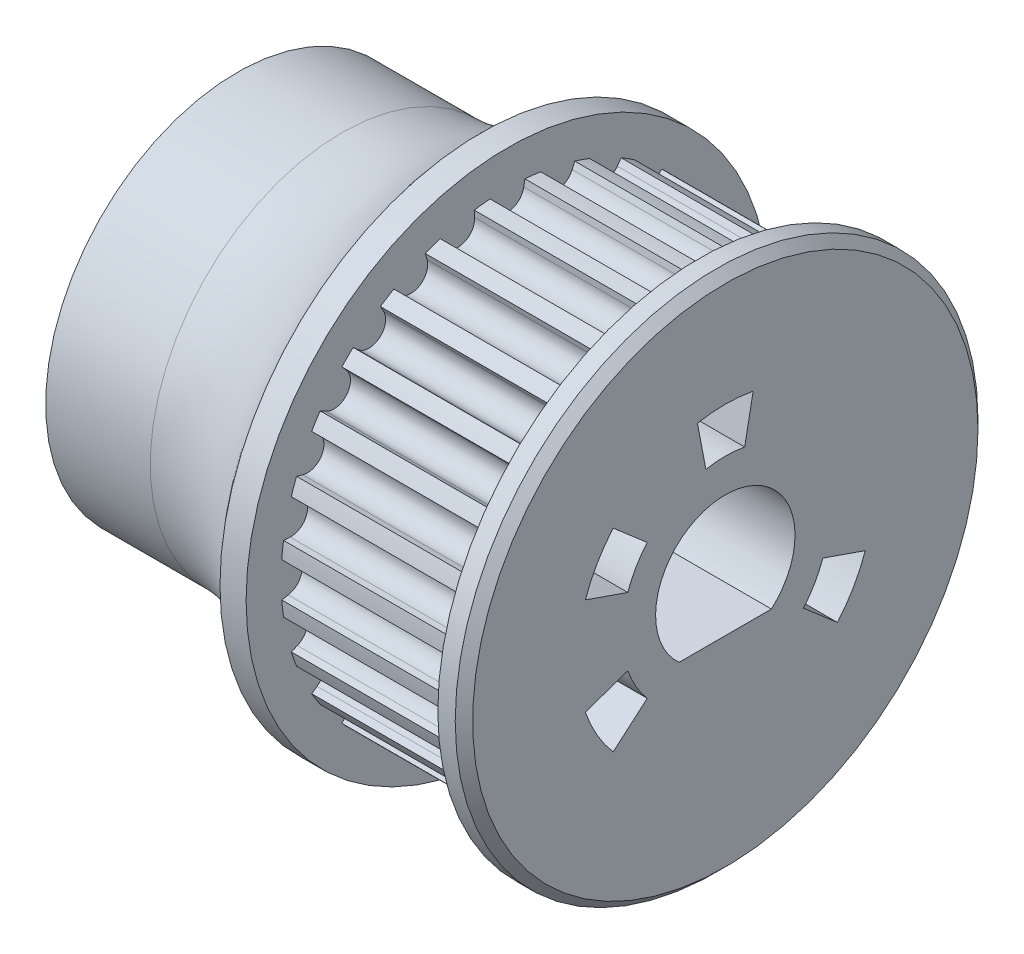
from build123d import *

# Parameters (mm, degrees)
SKETCH5_R               = 4
BOSS_EXTRUDE2_DEPTH     = 11
CUT_EXTRUDE1_DEPTH      = 36.128336141
CUT_EXTRUDE1_DEPTH_BACK = 36.128336141
CUT_EXTRUDE2_DEPTH      = 36.128336141
FILLET1_R               = 10
SKETCH9_R               = 2.5
CUT_EXTRUDE3_DEPTH      = 27.272609311
SKETCH10_R              = 2.5
CUT_EXTRUDE4_DEPTH      = 27.272609484
CHAMFER1_SIZE           = 0.5


with BuildPart() as part:
    # Sketch5 → Boss-Extrude2 (new body)
    with BuildSketch(Plane(origin=(0, 0, 0), x_dir=(0, 0, -1), z_dir=(1, 0, 0))):
        with BuildLine():
            Line((1, 12.951451656), (0.936385963, 12.579746051))
            ThreePointArc((0.936385963, 12.579746051), (0, 11.79), (-0.936385963, 12.579746051))
            Line((-0.936385963, 12.579746051), (-1, 12.951451656))
            ThreePointArc((-1, 12.951451656), (-1.454418545, 12.908321607), (-1.907041206, 12.849252657))
            Line((-1.907041206, 12.849252657), (-1.886348028, 12.472711032))
            ThreePointArc((-1.886348028, 12.472711032), (-2.623521811, 11.494400085), (-3.712165652, 12.055980074))
            Line((-3.712165652, 12.055980074), (-3.856897031, 12.404210789))
            ThreePointArc((-3.856897031, 12.404210789), (-4.290325015, 12.261044461), (-4.718455404, 12.102738475))
            Line((-4.718455404, 12.102738475), (-4.614492653, 11.740242201))
            ThreePointArc((-4.614492653, 11.740242201), (-5.115489284, 10.622422953), (-6.301801855, 10.927676915))
            Line((-6.301801855, 10.927676915), (-6.520393139, 11.234970997))
            ThreePointArc((-6.520393139, 11.234970997), (-6.911096674, 10.998947348), (-7.293266544, 10.74934245))
            Line((-7.293266544, 10.74934245), (-7.111247347, 10.419068602))
            ThreePointArc((-7.111247347, 10.419068602), (-7.350944764, 9.217793178), (-8.575439398, 9.251414405))
            Line((-8.575439398, 9.251414405), (-8.856929509, 9.502362847))
            ThreePointArc((-8.856929509, 9.502362847), (-9.185317088, 9.185317088), (-9.502362847, 8.856929509))
            Line((-9.502362847, 8.856929509), (-9.251414405, 8.575439398))
            ThreePointArc((-9.251414405, 8.575439398), (-9.217793178, 7.350944764), (-10.419068602, 7.111247347))
            Line((-10.419068602, 7.111247347), (-10.74934245, 7.293266544))
            ThreePointArc((-10.74934245, 7.293266544), (-10.998947348, 6.911096674), (-11.234970997, 6.520393139))
            Line((-11.234970997, 6.520393139), (-10.927676915, 6.301801855))
            ThreePointArc((-10.927676915, 6.301801855), (-10.622422953, 5.115489284), (-11.740242201, 4.614492653))
            Line((-11.740242201, 4.614492653), (-12.102738475, 4.718455404))
            ThreePointArc((-12.102738475, 4.718455404), (-12.261044461, 4.290325015), (-12.404210789, 3.856897031))
            Line((-12.404210789, 3.856897031), (-12.055980074, 3.712165652))
            ThreePointArc((-12.055980074, 3.712165652), (-11.494400085, 2.623521811), (-12.472711032, 1.886348028))
            Line((-12.472711032, 1.886348028), (-12.849252657, 1.907041206))
            ThreePointArc((-12.849252657, 1.907041206), (-12.908321607, 1.454418545), (-12.951451656, 1))
            Line((-12.951451656, 1), (-12.579746051, 0.936385963))
            ThreePointArc((-12.579746051, 0.936385963), (-11.79, 0), (-12.579746051, -0.936385963))
            Line((-12.579746051, -0.936385963), (-12.951451656, -1))
            ThreePointArc((-12.951451656, -1), (-12.908321607, -1.454418545), (-12.849252657, -1.907041206))
            Line((-12.849252657, -1.907041206), (-12.472711032, -1.886348028))
            ThreePointArc((-12.472711032, -1.886348028), (-11.494400085, -2.623521811), (-12.055980074, -3.712165652))
            Line((-12.055980074, -3.712165652), (-12.404210789, -3.856897031))
            ThreePointArc((-12.404210789, -3.856897031), (-12.261044461, -4.290325015), (-12.102738475, -4.718455404))
            Line((-12.102738475, -4.718455404), (-11.740242201, -4.614492653))
            ThreePointArc((-11.740242201, -4.614492653), (-10.622422953, -5.115489284), (-10.927676915, -6.301801855))
            Line((-10.927676915, -6.301801855), (-11.234970997, -6.520393139))
            ThreePointArc((-11.234970997, -6.520393139), (-10.998947348, -6.911096674), (-10.74934245, -7.293266544))
            Line((-10.74934245, -7.293266544), (-10.419068602, -7.111247347))
            ThreePointArc((-10.419068602, -7.111247347), (-9.217793178, -7.350944764), (-9.251414405, -8.575439398))
            Line((-9.251414405, -8.575439398), (-9.502362847, -8.856929509))
            ThreePointArc((-9.502362847, -8.856929509), (-9.185317088, -9.185317088), (-8.856929509, -9.502362847))
            Line((-8.856929509, -9.502362847), (-8.575439398, -9.251414405))
            ThreePointArc((-8.575439398, -9.251414405), (-7.350944764, -9.217793178), (-7.111247347, -10.419068602))
            Line((-7.111247347, -10.419068602), (-7.293266544, -10.74934245))
            ThreePointArc((-7.293266544, -10.74934245), (-6.911096674, -10.998947348), (-6.520393139, -11.234970997))
            Line((-6.520393139, -11.234970997), (-6.301801855, -10.927676915))
            ThreePointArc((-6.301801855, -10.927676915), (-5.115489284, -10.622422953), (-4.614492653, -11.740242201))
            Line((-4.614492653, -11.740242201), (-4.718455404, -12.102738475))
            ThreePointArc((-4.718455404, -12.102738475), (-4.290325015, -12.261044461), (-3.856897031, -12.404210789))
            Line((-3.856897031, -12.404210789), (-3.712165652, -12.055980074))
            ThreePointArc((-3.712165652, -12.055980074), (-2.623521811, -11.494400085), (-1.886348028, -12.472711032))
            Line((-1.886348028, -12.472711032), (-1.907041206, -12.849252657))
            ThreePointArc((-1.907041206, -12.849252657), (-1.454418545, -12.908321607), (-1, -12.951451656))
            Line((-1, -12.951451656), (-0.936385963, -12.579746051))
            ThreePointArc((-0.936385963, -12.579746051), (0, -11.79), (0.936385963, -12.579746051))
            Line((0.936385963, -12.579746051), (1, -12.951451656))
            ThreePointArc((1, -12.951451656), (1.454418545, -12.908321607), (1.907041206, -12.849252657))
            Line((1.907041206, -12.849252657), (1.886348028, -12.472711032))
            ThreePointArc((1.886348028, -12.472711032), (2.623521811, -11.494400085), (3.712165652, -12.055980074))
            Line((3.712165652, -12.055980074), (3.856897031, -12.404210789))
            ThreePointArc((3.856897031, -12.404210789), (4.290325015, -12.261044461), (4.718455404, -12.102738475))
            Line((4.718455404, -12.102738475), (4.614492653, -11.740242201))
            ThreePointArc((4.614492653, -11.740242201), (5.115489284, -10.622422953), (6.301801855, -10.927676915))
            Line((6.301801855, -10.927676915), (6.520393139, -11.234970997))
            ThreePointArc((6.520393139, -11.234970997), (6.911096674, -10.998947348), (7.293266544, -10.74934245))
            Line((7.293266544, -10.74934245), (7.111247347, -10.419068602))
            ThreePointArc((7.111247347, -10.419068602), (7.350944764, -9.217793178), (8.575439398, -9.251414405))
            Line((8.575439398, -9.251414405), (8.856929509, -9.502362847))
            ThreePointArc((8.856929509, -9.502362847), (9.185317088, -9.185317088), (9.502362847, -8.856929509))
            Line((9.502362847, -8.856929509), (9.251414405, -8.575439398))
            ThreePointArc((9.251414405, -8.575439398), (9.217793178, -7.350944764), (10.419068602, -7.111247347))
            Line((10.419068602, -7.111247347), (10.74934245, -7.293266544))
            ThreePointArc((10.74934245, -7.293266544), (10.998947348, -6.911096674), (11.234970997, -6.520393139))
            Line((11.234970997, -6.520393139), (10.927676915, -6.301801855))
            ThreePointArc((10.927676915, -6.301801855), (10.622422953, -5.115489284), (11.740242201, -4.614492653))
            Line((11.740242201, -4.614492653), (12.102738475, -4.718455404))
            ThreePointArc((12.102738475, -4.718455404), (12.261044461, -4.290325015), (12.404210789, -3.856897031))
            Line((12.404210789, -3.856897031), (12.055980074, -3.712165652))
            ThreePointArc((12.055980074, -3.712165652), (11.494400085, -2.623521811), (12.472711032, -1.886348028))
            Line((12.472711032, -1.886348028), (12.849252657, -1.907041206))
            ThreePointArc((12.849252657, -1.907041206), (12.908321607, -1.454418545), (12.951451656, -1))
            Line((12.951451656, -1), (12.579746051, -0.936385963))
            ThreePointArc((12.579746051, -0.936385963), (11.79, 0), (12.579746051, 0.936385963))
            Line((12.579746051, 0.936385963), (12.951451656, 1))
            ThreePointArc((12.951451656, 1), (12.908321607, 1.454418545), (12.849252657, 1.907041206))
            Line((12.849252657, 1.907041206), (12.472711032, 1.886348028))
            ThreePointArc((12.472711032, 1.886348028), (11.494400085, 2.623521811), (12.055980074, 3.712165652))
            Line((12.055980074, 3.712165652), (12.404210789, 3.856897031))
            ThreePointArc((12.404210789, 3.856897031), (12.261044461, 4.290325015), (12.102738475, 4.718455404))
            Line((12.102738475, 4.718455404), (11.740242201, 4.614492653))
            ThreePointArc((11.740242201, 4.614492653), (10.622422953, 5.115489284), (10.927676915, 6.301801855))
            Line((10.927676915, 6.301801855), (11.234970997, 6.520393139))
            ThreePointArc((11.234970997, 6.520393139), (10.998947348, 6.911096674), (10.74934245, 7.293266544))
            Line((10.74934245, 7.293266544), (10.419068602, 7.111247347))
            ThreePointArc((10.419068602, 7.111247347), (9.217793178, 7.350944764), (9.251414405, 8.575439398))
            Line((9.251414405, 8.575439398), (9.502362847, 8.856929509))
            ThreePointArc((9.502362847, 8.856929509), (9.185317088, 9.185317088), (8.856929509, 9.502362847))
            Line((8.856929509, 9.502362847), (8.575439398, 9.251414405))
            ThreePointArc((8.575439398, 9.251414405), (7.350944764, 9.217793178), (7.111247347, 10.419068602))
            Line((7.111247347, 10.419068602), (7.293266544, 10.74934245))
            ThreePointArc((7.293266544, 10.74934245), (6.911096674, 10.998947348), (6.520393139, 11.234970997))
            Line((6.520393139, 11.234970997), (6.301801855, 10.927676915))
            ThreePointArc((6.301801855, 10.927676915), (5.115489284, 10.622422953), (4.614492653, 11.740242201))
            Line((4.614492653, 11.740242201), (4.718455404, 12.102738475))
            ThreePointArc((4.718455404, 12.102738475), (4.290325015, 12.261044461), (3.856897031, 12.404210789))
            Line((3.856897031, 12.404210789), (3.712165652, 12.055980074))
            ThreePointArc((3.712165652, 12.055980074), (2.623521811, 11.494400085), (1.886348028, 12.472711032))
            Line((1.886348028, 12.472711032), (1.907041206, 12.849252657))
            ThreePointArc((1.907041206, 12.849252657), (1.454418545, 12.908321607), (1, 12.951451656))
        make_face()
        with Locations(Location((0, 0, 0), (0, 0, 180))):
            Circle(SKETCH5_R, mode=Mode.SUBTRACT)
    extrude(amount=BOSS_EXTRUDE2_DEPTH)

    # Sketch2 → Revolve1 (revolve)
    with BuildSketch(Plane.XY, mode=Mode.PRIVATE) as revolve1_sk:
        Polygon((0, 11), (0, 15), (-1.5, 15), (-1.5, 11), (-15.5, 11), (-15.5, 0), (12.5, 0), (12.5, 15), (11, 15), (11, 11), align=None)
    revolve(revolve1_sk.sketch.rotate(Axis((13.9, 0, 0), (-1, 0, 0)), 90), axis=Axis((13.9, 0, 0), (-1, 0, 0)))

    # Sketch3 → Cut-Extrude1 (cut, two sides: drawn at the far end of the back side and taken through both)
    with BuildSketch(Plane.ZY.offset(15.5).offset(-CUT_EXTRUDE1_DEPTH_BACK)):
        with BuildLine():
            Line((-2.645751311, -3), (2.645751311, -3))
            ThreePointArc((2.645751311, -3), (0, 4), (-2.645751311, -3))
        make_face()
    extrude(amount=CUT_EXTRUDE1_DEPTH + CUT_EXTRUDE1_DEPTH_BACK, mode=Mode.SUBTRACT)

    # Sketch7 → Cut-Extrude2 (cut, through all)
    with BuildSketch(Plane.ZY.offset(15.5)):
        with BuildLine():
            Line((-1.597784484, 8.352055259), (-1.11303846, 5.818155587))
            ThreePointArc((-1.11303846, 5.818155587), (0, 5.923663482), (1.11303846, 5.818155587))
            Line((1.11303846, 5.818155587), (1.597784484, 8.352055259))
            ThreePointArc((1.597784484, 8.352055259), (0, 8.503513527), (-1.597784484, 8.352055259))
        make_face()
        with BuildLine():
            Line((5.595189771, 1.945158212), (8.03198427, 2.792305676))
            ThreePointArc((8.03198427, 2.792305676), (7.364258736, 4.251756764), (6.434199786, 5.559749583))
            Line((6.434199786, 5.559749583), (4.482151311, 3.872997375))
            ThreePointArc((4.482151311, 3.872997375), (5.130043059, 2.961831741), (5.595189771, 1.945158212))
        make_face()
        with BuildLine():
            Line((4.482151311, -3.872997375), (6.434199786, -5.559749583))
            ThreePointArc((6.434199786, -5.559749583), (7.364258736, -4.251756764), (8.03198427, -2.792305676))
            Line((8.03198427, -2.792305676), (5.595189771, -1.945158212))
            ThreePointArc((5.595189771, -1.945158212), (5.130043059, -2.961831741), (4.482151311, -3.872997375))
        make_face()
        with BuildLine():
            Line((-5.595189771, -1.945158212), (-8.03198427, -2.792305676))
            ThreePointArc((-8.03198427, -2.792305676), (-7.364258736, -4.251756764), (-6.434199786, -5.559749583))
            Line((-6.434199786, -5.559749583), (-4.482151311, -3.872997375))
            ThreePointArc((-4.482151311, -3.872997375), (-5.130043059, -2.961831741), (-5.595189771, -1.945158212))
        make_face()
    extrude(amount=-CUT_EXTRUDE2_DEPTH, mode=Mode.SUBTRACT)

    # Fillet1
    # the kernel refuses this fillet: 10 mm, written as the material it adds along each edge
    with BuildSketch(Plane(origin=(-1.5, 0, 0), x_dir=(0, 0, -1), z_dir=(0, 1, 0))) as fillet1_piece_1:
        with BuildLine():
            CenterArc((21, 8), FILLET1_R, 180, 53.130102354)
            Line((11, 8), (10.8, 8))
            Line((10.8, 8), (10.8, 0))
            Line((10.8, 0), (11, -0.2))
            ThreePointArc((11, -0.2), (13, -0.2), (14.88, -0.16))
            Line((14.88, -0.16), (15, 0))
        make_face()
    revolve(axis=Axis((-1.5, 0, 0), (-1, 0, 0)))

    # Sketch9 → Cut-Extrude3 (cut, through all)
    with BuildSketch(Plane(origin=(0, 0, 0), x_dir=(1, 0, 0), z_dir=(0, 1, 0))):
        with Locations(Location((-10.5, 0, 0), (0, 0, 293.578178478))):
            Circle(SKETCH9_R)
    extrude(amount=-CUT_EXTRUDE3_DEPTH, mode=Mode.SUBTRACT)

    # Sketch10 → Cut-Extrude4 (cut, through all)
    with BuildSketch(Plane(origin=(0, 0, 0), x_dir=(-1, 0, 0), z_dir=(0, -0.5000000000000041, 0.8660254037844364))):
        with Locations(Location((10.5, 0, 0), (0, 0, 90))):
            Circle(SKETCH10_R)
    extrude(amount=-CUT_EXTRUDE4_DEPTH, mode=Mode.SUBTRACT)

    # Chamfer1
    chamfer1_edges = [part.edges().sort_by_distance(p)[0] for p in [
        (12.5, 0, 15),
    ]]
    chamfer(chamfer1_edges, length=CHAMFER1_SIZE)


solid = part.part
